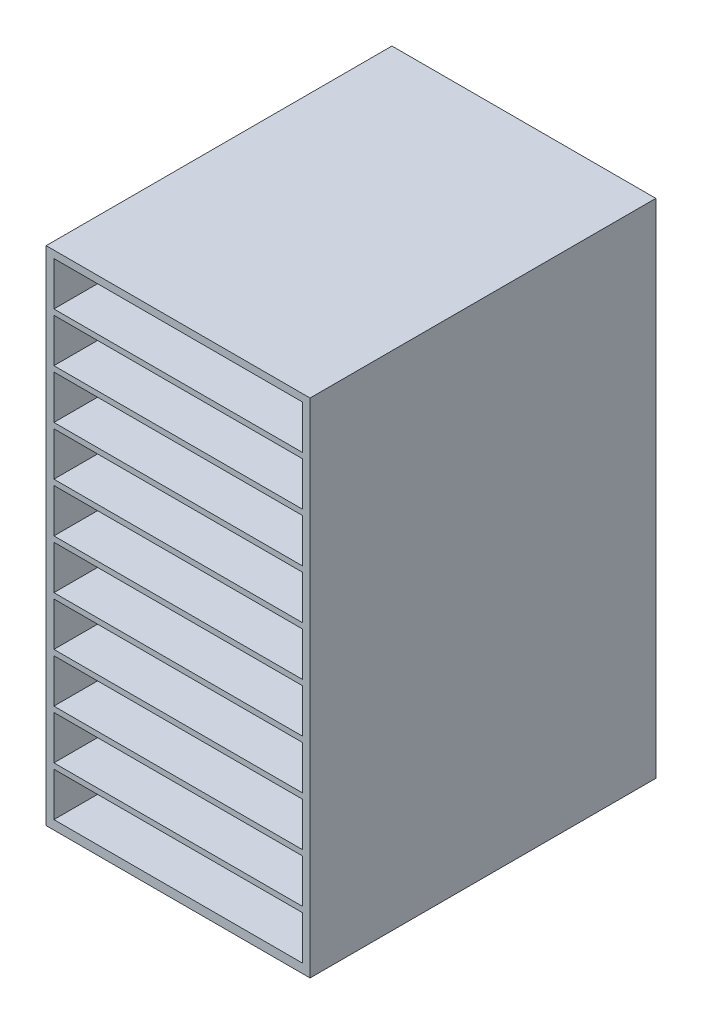
from build123d import *

# Parameters (mm, degrees)
SKETCH1_W           = 72.5
SKETCH1_H           = 95
BOSS_EXTRUDE1_DEPTH = 104.5
SKETCH2_W           = 68.25
SKETCH2_H           = 22.5
CUT_EXTRUDE1_DEPTH  = 90
SKETCH3_W           = 72.5
SKETCH3_H           = 95
BOSS_EXTRUDE2_DEPTH = 175.5
SKETCH4_W           = 68.25
SKETCH4_H           = 12
CUT_EXTRUDE3_DEPTH  = 90
SPLIT1_OUTLINE_W    = 72.5
SPLIT1_OUTLINE_H    = 95
SPLIT1_DEPTH        = 144.5
SKETCH5_W           = 72.5
SKETCH5_H           = 95
BOSS_EXTRUDE3_DEPTH = 2.5


# Read off the part's stored shape, not the designer's step: Split1
with BuildPart() as part:
    # Sketch1 → Boss-Extrude1 (new body)
    with BuildSketch(Plane(origin=(0, 0, 0), x_dir=(1, 0, 0), z_dir=(0, 1, 0))):
        Rectangle(SKETCH1_W, SKETCH1_H)
    extrude(amount=BOSS_EXTRUDE1_DEPTH)

    # Sketch2 → Cut-Extrude1 (cut)
    with BuildSketch(Plane.XY.offset(47.5)):
        with Locations((0, 13.75)):
            Rectangle(SKETCH2_W, SKETCH2_H)
        with Locations((0, 39.25)):
            Rectangle(SKETCH2_W, SKETCH2_H)
        with Locations((0, 64.75)):
            Rectangle(SKETCH2_W, SKETCH2_H)
        with Locations((0, 90.25)):
            Rectangle(SKETCH2_W, SKETCH2_H)
    extrude(amount=-CUT_EXTRUDE1_DEPTH, mode=Mode.SUBTRACT)

    # Sketch3 → Boss-Extrude2 (add)
    with BuildSketch(Plane(origin=(0, 104.5, 0), x_dir=(1, 0, 0), z_dir=(0, 1, 0))):
        Rectangle(SKETCH3_W, SKETCH3_H)
    extrude(amount=BOSS_EXTRUDE2_DEPTH)

    # Sketch4 → Cut-Extrude3 (cut)
    with BuildSketch(Plane.XY.offset(47.5)):
        with Locations((0, 110)):
            Rectangle(SKETCH4_W, SKETCH4_H)
        with Locations((0, 123.5)):
            Rectangle(SKETCH4_W, SKETCH4_H)
        with Locations((0, 137)):
            Rectangle(SKETCH4_W, SKETCH4_H)
        with Locations((0, 150.5)):
            Rectangle(SKETCH4_W, SKETCH4_H)
        with Locations((0, 164)):
            Rectangle(SKETCH4_W, SKETCH4_H)
        with Locations((0, 177.5)):
            Rectangle(SKETCH4_W, SKETCH4_H)
        with Locations((0, 191)):
            Rectangle(SKETCH4_W, SKETCH4_H)
        with Locations((0, 204.5)):
            Rectangle(SKETCH4_W, SKETCH4_H)
        with Locations((0, 218)):
            Rectangle(SKETCH4_W, SKETCH4_H)
        with Locations((0, 231.5)):
            Rectangle(SKETCH4_W, SKETCH4_H)
        with Locations((0, 245)):
            Rectangle(SKETCH4_W, SKETCH4_H)
        with Locations((0, 258.5)):
            Rectangle(SKETCH4_W, SKETCH4_H)
        with Locations((0, 272)):
            Rectangle(SKETCH4_W, SKETCH4_H)
    extrude(amount=-CUT_EXTRUDE3_DEPTH, mode=Mode.SUBTRACT)

    # Split1 outline → Split1 (cut)
    with BuildSketch(Plane(origin=(0, 0, 0), x_dir=(1, 0, 0), z_dir=(0, 1, 0))):
        Rectangle(SPLIT1_OUTLINE_W, SPLIT1_OUTLINE_H)
    extrude(amount=SPLIT1_DEPTH, mode=Mode.SUBTRACT)

    # Sketch5 → Boss-Extrude3 (add)
    with BuildSketch(Plane.XZ.offset(-144.5)):
        Rectangle(SKETCH5_W, SKETCH5_H)
    extrude(amount=BOSS_EXTRUDE3_DEPTH)


solid = part.part
